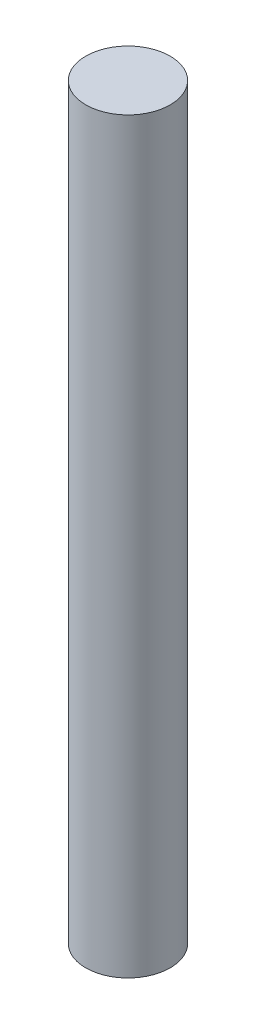
from build123d import *

# Parameters (mm, degrees)
CROQUIS1_R              = 4
SALIENTE_EXTRUIR1_DEPTH = 100
CROQUIS2_W              = 17.968690684
CROQUIS2_H              = 31.653106042
CORTAR_EXTRUIR1_DEPTH   = 23


with BuildPart() as part:
    # Croquis1 → Saliente-Extruir1 (new body)
    with BuildSketch(Plane(origin=(0, 0, 0), x_dir=(1, 0, 0), z_dir=(0, 1, 0))):
        Circle(CROQUIS1_R)
    extrude(amount=SALIENTE_EXTRUIR1_DEPTH)

    # Croquis2 → Cortar-Extruir1 (cut)
    with BuildSketch(Plane(origin=(1.865116051, 0, 3.53855085), x_dir=(0.884637712395876, 0, -0.46627901283136425), z_dir=(0.4662790128313642, 0, 0.8846377123958759))):
        with Locations((0.165622699, 13.369561391)):
            Rectangle(CROQUIS2_W, CROQUIS2_H)
    extrude(amount=-CORTAR_EXTRUIR1_DEPTH, mode=Mode.SUBTRACT)


solid = part.part
